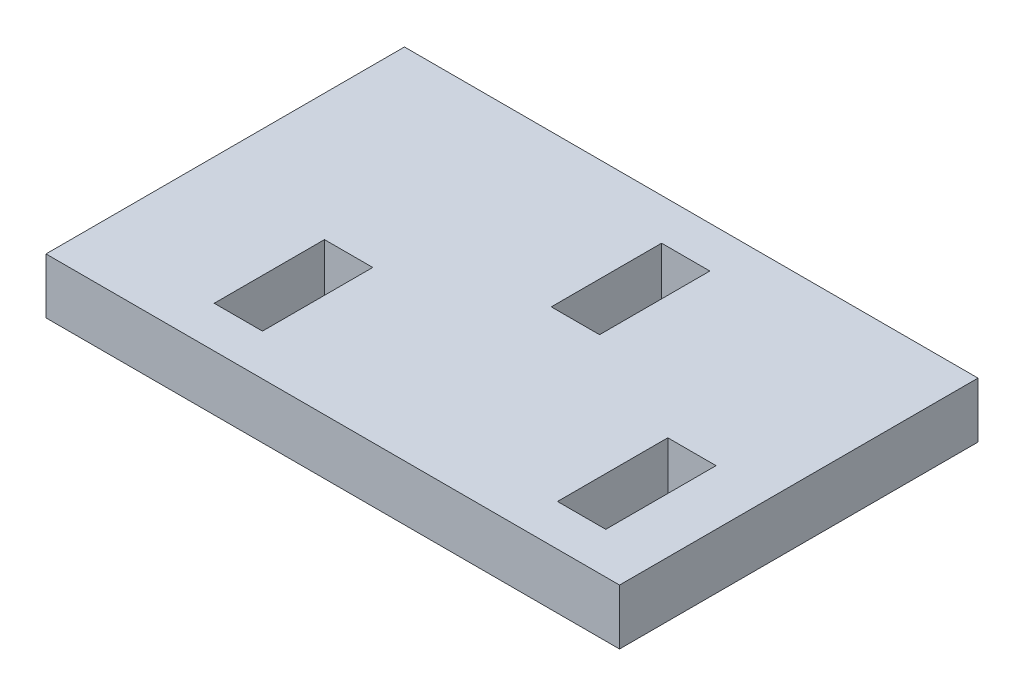
from build123d import *

# Parameters (mm, degrees)
SKETCH1_W           = 52.832
SKETCH1_H           = 33.02
BOSS_EXTRUDE1_DEPTH = 5.1054
SKETCH2_W           = 4.445
SKETCH2_H           = 10.16
CUT_EXTRUDE1_DEPTH  = 32.566600469


with BuildPart() as part:
    # Sketch1 → Boss-Extrude1 (new body)
    with BuildSketch(Plane(origin=(0, 0, 0), x_dir=(1, 0, 0), z_dir=(0, 1, 0))):
        Rectangle(SKETCH1_W, SKETCH1_H)
    extrude(amount=BOSS_EXTRUDE1_DEPTH)

    # Sketch2 → Cut-Extrude1 (cut, through all)
    with BuildSketch(Plane(origin=(0, 5.1054, 0), x_dir=(1, 0, 0), z_dir=(0, 1, 0))):
        with Locations((19.1135, -7.62)):
            Rectangle(SKETCH2_W, SKETCH2_H)
        with Locations((3.302, 7.62)):
            Rectangle(SKETCH2_W, SKETCH2_H)
        with Locations((-12.5095, -7.62)):
            Rectangle(SKETCH2_W, SKETCH2_H)
    extrude(amount=-CUT_EXTRUDE1_DEPTH, mode=Mode.SUBTRACT)


solid = part.part
